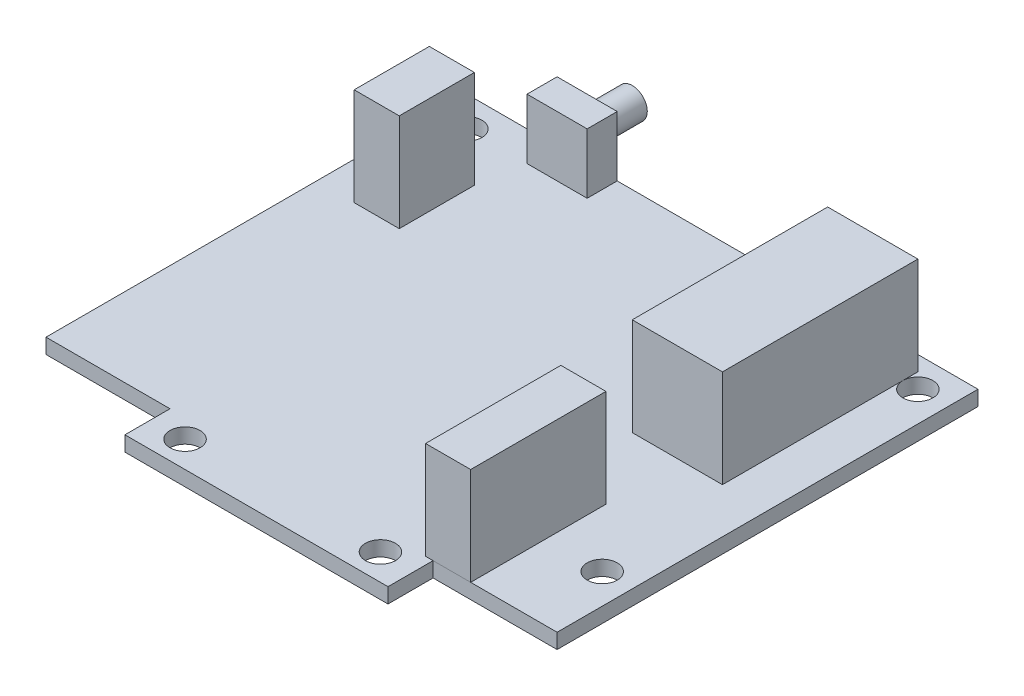
from build123d import *

# Parameters (mm, degrees)
BOSS_EXTRUDE1_DEPTH   = 1.5875
SKETCH2_W             = 4.7625
SKETCH2_H             = 14.2875
BOSS_EXTRUDE2_DEPTH   = 10.31875
SKETCH2_H_2           = 7.9375
BOSS_EXTRUDE2_2_DEPTH = 10.31875
SKETCH2_W_2           = 6.35
SKETCH2_H_3           = 3.175
BOSS_EXTRUDE2_3_DEPTH = 10.31875
SKETCH2_W_3           = 9.525
SKETCH2_H_4           = 20.6375
BOSS_EXTRUDE2_4_DEPTH = 10.31875
SKETCH3_R             = 1.5875
BOSS_EXTRUDE3_DEPTH   = 4.7625
SKETCH4_W             = 6.35
SKETCH4_H             = 3.96875
CUT_EXTRUDE1_DEPTH    = 58.37555317
BOSS_EXTRUDE4_DEPTH   = 7.9375
BOSS_EXTRUDE5_DEPTH   = 6.35
SKETCH7_R             = 1.5875
CUT_EXTRUDE2_DEPTH    = 41.752705048
SKETCH9_W             = 3.175
SKETCH9_H             = 2.38125
BOSS_EXTRUDE6_DEPTH   = 1.5875


with BuildPart() as part:
    # Sketch1 → Boss-Extrude1 (new body)
    with BuildSketch(Plane(origin=(0, 0, 0), x_dir=(1, 0, 0), z_dir=(0, 1, 0))):
        Polygon((13.890625, -22.225), (26.9875, -22.225), (26.9875, 22.225), (-26.9875, 22.225), (-26.9875, -22.225), (-13.890625, -22.225), (-13.890625, -26.9875), (13.890625, -26.9875), align=None)
    extrude(amount=BOSS_EXTRUDE1_DEPTH)

    # Sketch5 → Boss-Extrude4 (add)
    with BuildSketch(Plane.XZ):
        with BuildLine():
            Line((8.73125, -20.6375), (-8.73125, -20.6375))
            Line((-8.73125, -20.6375), (-8.73125, -13.890625))
            Line((-8.73125, -13.890625), (-10.31875, -13.890625))
            ThreePointArc((-10.31875, -13.890625), (-12.303125, -11.90625), (-10.31875, -9.921875))
            Line((-10.31875, -9.921875), (-8.73125, -9.921875))
            Line((-8.73125, -9.921875), (-8.73125, -3.175))
            Line((-8.73125, -3.175), (8.73125, -3.175))
            Line((8.73125, -3.175), (8.73125, -9.921875))
            Line((8.73125, -9.921875), (10.31875, -9.921875))
            ThreePointArc((10.31875, -9.921875), (12.303125, -11.90625), (10.31875, -13.890625))
            Line((10.31875, -13.890625), (8.73125, -13.890625))
            Line((8.73125, -13.890625), (8.73125, -20.6375))
        make_face()
    extrude(amount=BOSS_EXTRUDE4_DEPTH)

    # Sketch6 → Boss-Extrude5 (add)
    with BuildSketch(Plane.XZ.offset(7.9375)):
        with BuildLine():
            Line((1.190625, -20.6375), (-1.190625, -20.6375))
            Line((-1.190625, -20.6375), (-1.190625, -19.753945099))
            ThreePointArc((-1.190625, -19.753945099), (0, -3.96875), (1.190625, -19.753945099))
            Line((1.190625, -19.753945099), (1.190625, -20.6375))
        make_face()
    extrude(amount=BOSS_EXTRUDE5_DEPTH)

    # Sketch7 → Cut-Extrude2 (cut, through all)
    with BuildSketch(Plane.XZ):
        with Locations((23.8125, -19.05)):
            Circle(SKETCH7_R)
        with Locations((-23.8125, -19.05)):
            Circle(SKETCH7_R)
        with Locations((-10.31875, 24.209375)):
            Circle(SKETCH7_R)
        with Locations((10.31875, 24.209375)):
            Circle(SKETCH7_R)
        with Locations((23.8125, 14.2875)):
            Circle(SKETCH7_R)
    extrude(amount=-CUT_EXTRUDE2_DEPTH, mode=Mode.SUBTRACT)

    # Sketch9 → Boss-Extrude6 (add)
    with BuildSketch(Plane.XZ):
        with Locations((0, 23.415625)):
            Rectangle(SKETCH9_W, SKETCH9_H)
    extrude(amount=BOSS_EXTRUDE6_DEPTH)


with BuildPart() as body_2:
    # Sketch2 → Boss-Extrude2 (new body)
    with BuildSketch(Plane(origin=(0, 1.5875, 0), x_dir=(1, 0, 0), z_dir=(0, 1, 0))):
        with Locations((15.478125, -15.08125)):
            Rectangle(SKETCH2_W, SKETCH2_H)
    extrude(amount=BOSS_EXTRUDE2_DEPTH)


with BuildPart() as body_3:
    # Sketch2 → Boss-Extrude2 2 (new body)
    with BuildSketch(Plane(origin=(0, 1.5875, 0), x_dir=(1, 0, 0), z_dir=(0, 1, 0))):
        with Locations((-20.6375, 10.31875)):
            Rectangle(SKETCH2_W, SKETCH2_H_2)
    extrude(amount=BOSS_EXTRUDE2_2_DEPTH)


with BuildPart() as body_4:
    # Sketch2 → Boss-Extrude2 3 (new body)
    with BuildSketch(Plane(origin=(0, 1.5875, 0), x_dir=(1, 0, 0), z_dir=(0, 1, 0))):
        with Locations((-14.2875, 20.6375)):
            Rectangle(SKETCH2_W_2, SKETCH2_H_3)
    extrude(amount=BOSS_EXTRUDE2_3_DEPTH)

    # Sketch4 → Cut-Extrude1 (cut, through all)
    with BuildSketch(Plane(origin=(0, 0, -22.225), x_dir=(-1, 0, 0), z_dir=(0, 0, -1))):
        with Locations((14.2875, 9.921875)):
            Rectangle(SKETCH4_W, SKETCH4_H)
    extrude(amount=-CUT_EXTRUDE1_DEPTH, mode=Mode.SUBTRACT)


with BuildPart() as body_5:
    # Sketch2 → Boss-Extrude2 4 (new body)
    with BuildSketch(Plane(origin=(0, 1.5875, 0), x_dir=(1, 0, 0), z_dir=(0, 1, 0))):
        with Locations((17.4625, 10.31875)):
            Rectangle(SKETCH2_W_3, SKETCH2_H_4)
    extrude(amount=BOSS_EXTRUDE2_4_DEPTH)


with BuildPart() as body_6:
    # Sketch3 → Boss-Extrude3 (new body)
    with BuildSketch(Plane(origin=(0, 0, -22.225), x_dir=(-1, 0, 0), z_dir=(0, 0, -1))):
        with Locations((14.2875, 4.7625)):
            Circle(SKETCH3_R)
    extrude(amount=BOSS_EXTRUDE3_DEPTH)


solid = Compound([part.part, body_2.part, body_3.part, body_4.part, body_5.part, body_6.part])
